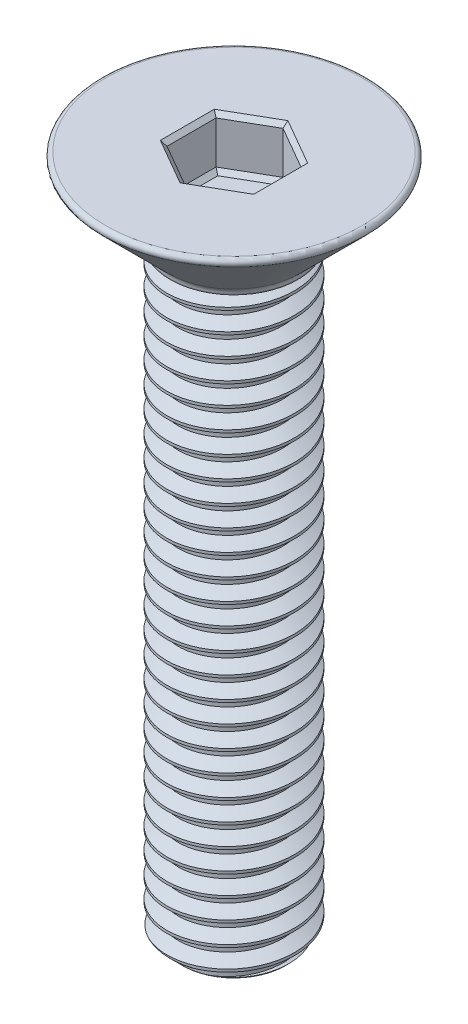
from build123d import *

# Parameters (mm, degrees)
SKETCH1_R           = 1.5
BOSS_EXTRUDE1_DEPTH = 14.14
THREAD1_PITCH       = 0.5
SKETCH5_R           = 1.5
BOSS_EXTRUDE2_DEPTH = 0.1
SKETCH6_R           = 1.5
BOSS_EXTRUDE3_DEPTH = 1.76
BOSS_EXTRUDE3_DRAFT = -45
FILLET1_R           = 0.1
FILLET2_R           = 0.2
CUT_EXTRUDE1_DEPTH  = 1.1
CHAMFER1_SIZE       = 0.1
CUT_EXTRUDE2_DEPTH  = 0.1
CUT_EXTRUDE2_DRAFT  = -45


with BuildPart() as part:
    # Sketch1 → Boss-Extrude1 (new body)
    with BuildSketch(Plane(origin=(0, 0, 0), x_dir=(1, 0, 0), z_dir=(0, 1, 0))):
        with Locations(Location((0, 0, 0), (0, 0, 270))):
            Circle(SKETCH1_R)
    extrude(amount=BOSS_EXTRUDE1_DEPTH)

    # Thread1: the profile of Thread Profile1 profile screwed along a right-hand helix of 30.28 turns, 6 arcs to a turn; built about Z, then put on its axis
    thread1_z = Axis((0, 0, 0), (0, 0, 1))
    thread1_corners = [(1.5003, 0, -0.000173205), (1.5003, 0, 0.437673204), (1.229367063, 0, 0.281249999), (1.229367063, 0, 0.156249999)]
    with BuildLine(mode=Mode.PRIVATE) as thread1_profile:
        Line(thread1_corners[0], thread1_corners[1])
        Line(thread1_corners[1], thread1_corners[2])
        Line(thread1_corners[2], thread1_corners[3])
        Line(thread1_corners[3], thread1_corners[0])
    thread1_cap = Face(thread1_profile.wire())
    thread1_turn_angles = [0, 30, 60, 90, 120, 150, 180, 210, 240, 270, 300, 330, 360]
    thread1_turn_weights = [1, 0.8660254037844387, 1, 0.8660254037844387, 1, 0.8660254037844387, 1, 0.8660254037844387, 1, 0.8660254037844387, 1, 0.8660254037844387, 1]
    thread1_turn_rails = [Edge.make_bspline([Vector(p[0], p[1], 0).rotate(thread1_z, thread1_turn_angles[k]) / thread1_turn_weights[k] + Vector(0, 0, p[2] + THREAD1_PITCH * thread1_turn_angles[k] / 360) for k in range(13)], [0, 0, 0, 1, 1, 2, 2, 3, 3, 4, 4, 5, 5, 6, 6, 6], 2, thread1_turn_weights) for p in thread1_corners]
    thread1_turn_sides = [Face.make_surface_from_curves(thread1_turn_rails[p[0]], thread1_turn_rails[p[1]]) for p in [(0, 1), (1, 2), (2, 3), (3, 0)]]
    thread1_last_angles = [10800, 10830, 10860, 10880.4, 10900.8]
    thread1_last_weights = [1, 0.8660254037844387, 1, 0.9372819894918881, 1]
    thread1_last_rails = [Edge.make_bspline([Vector(p[0], p[1], 0).rotate(thread1_z, thread1_last_angles[k]) / thread1_last_weights[k] + Vector(0, 0, p[2] + THREAD1_PITCH * thread1_last_angles[k] / 360) for k in range(5)], [0, 0, 0, 1, 1, 2, 2, 2], 2, thread1_last_weights) for p in thread1_corners]
    thread1_last_sides = [Face.make_surface_from_curves(thread1_last_rails[p[0]], thread1_last_rails[p[1]]) for p in [(0, 1), (1, 2), (2, 3), (3, 0)]]
    thread1 = Plane(origin=(0, 15.14, 0), x_dir=(-1, 0, 0), z_dir=(0, -1, 0)) * Solid(Shell([*[p.moved(Location((0, 0, THREAD1_PITCH * i))) for i in range(30) for p in thread1_turn_sides], *thread1_last_sides, thread1_cap, thread1_cap.rotate(thread1_z, 10900.8).moved(Location((0, 0, THREAD1_PITCH * 10900.8 / 360)))]))
    add(thread1, mode=Mode.SUBTRACT)

    # Sketch5 → Boss-Extrude2 (add)
    with BuildSketch(Plane(origin=(0, 14.14, 0), x_dir=(1, 0, 0), z_dir=(0, 1, 0))):
        with Locations(Location((0, 0, 0), (0, 0, 79.630240195))):
            Circle(SKETCH5_R)
    extrude(amount=BOSS_EXTRUDE2_DEPTH)


with BuildPart() as boss_extrude3_tool:
    # Sketch6 → Boss-Extrude3 (with draft: the straight prism first)
    with BuildSketch(Plane(origin=(0, 14.24, 0), x_dir=(1, 0, 0), z_dir=(0, 1, 0))):
        with Locations(Location((0, 0, 0), (0, 0, 79.630240195))):
            Circle(SKETCH6_R)
    extrude(amount=BOSS_EXTRUDE3_DEPTH)
    # Boss-Extrude3: the draft: its side faces are tilted about the plane it starts from
    boss_extrude3_sides = [boss_extrude3_tool.faces().sort_by_distance(p)[0] for p in [
        (-0.27, 15.12, 1.475499915),
    ]]
    draft(boss_extrude3_sides, Plane(origin=(0, 14.24, 0), x_dir=(1, 0, 0), z_dir=(0, 1, 0)), BOSS_EXTRUDE3_DRAFT)


with BuildPart() as part_1:
    add(part.part)

    # Boss-Extrude3: add boss_extrude3_tool
    add(boss_extrude3_tool.part)

    # Sketch7 → Cut-Revolve1 (revolve, cut)
    with BuildSketch(Plane.XY, mode=Mode.PRIVATE) as cut_revolve1_sk:
        Polygon((1.51, 0), (1.51, 0.3), (1.21, 0), align=None)
    revolve(cut_revolve1_sk.sketch.rotate(Axis((0, 0, 0), (0, 1, 0)), 135.522486844), axis=Axis((0, 0, 0), (0, 1, 0)), mode=Mode.SUBTRACT)

    # Fillet1
    fillet1_edges = [part_1.edges().sort_by_distance(p)[0] for p in [
        (-0.5868, 16, 3.206753149),
    ]]
    fillet(fillet1_edges, radius=FILLET1_R)

    # Fillet2
    fillet2_edges = [part_1.edges().sort_by_distance(p)[0] for p in [
        (-0.27, 14.24, 1.475499915),
    ]]
    fillet(fillet2_edges, radius=FILLET2_R)

    # Sketch8 → Cut-Extrude1 (cut)
    with BuildSketch(Plane(origin=(0, 16, 0), x_dir=(1, 0, 0), z_dir=(0, 1, 0))):
        Polygon((0, 1.154700538), (-1, 0.577350269), (-1, -0.577350269), (0, -1.154700538), (1, -0.577350269), (1, 0.577350269), align=None)
    extrude(amount=-CUT_EXTRUDE1_DEPTH, mode=Mode.SUBTRACT)

    # Chamfer1
    chamfer1_edges = [part_1.edges().sort_by_distance(p)[0] for p in [
        (0.5, 16, -0.866025404),
        (-0.5, 16, -0.866025404),
        (-1, 16, 0),
        (-0.5, 16, 0.866025404),
        (0.5, 16, 0.866025404),
        (1, 16, 0),
    ]]
    chamfer(chamfer1_edges, length=CHAMFER1_SIZE)


with BuildPart() as cut_extrude2_tool:
    # Sketch9 → Cut-Extrude2 (with draft: the straight prism first)
    with BuildSketch(Plane(origin=(0, 14.9, 0), x_dir=(1, 0, 0), z_dir=(0, 1, 0))):
        Polygon((0, 1.154700538), (-1, 0.577350269), (-1, -0.577350269), (0, -1.154700538), (1, -0.577350269), (1, 0.577350269), align=None)
    extrude(amount=-CUT_EXTRUDE2_DEPTH)
    # Cut-Extrude2: the draft: its side faces are tilted about the plane it starts from
    cut_extrude2_sides = [cut_extrude2_tool.faces().sort_by_distance(p)[0] for p in [
        (-0.5, 14.85, -0.866025404),
        (-1, 14.85, 0),
        (-0.5, 14.85, 0.866025404),
        (0.5, 14.85, 0.866025404),
        (1, 14.85, 0),
        (0.5, 14.85, -0.866025404),
    ]]
    draft(cut_extrude2_sides, Plane(origin=(0, 14.9, 0), x_dir=(1, 0, 0), z_dir=(0, 1, 0)), CUT_EXTRUDE2_DRAFT)


with BuildPart() as part_2:
    add(part_1.part)

    # Cut-Extrude2: cut by cut_extrude2_tool
    add(cut_extrude2_tool.part, mode=Mode.SUBTRACT)


solid = part_2.part
